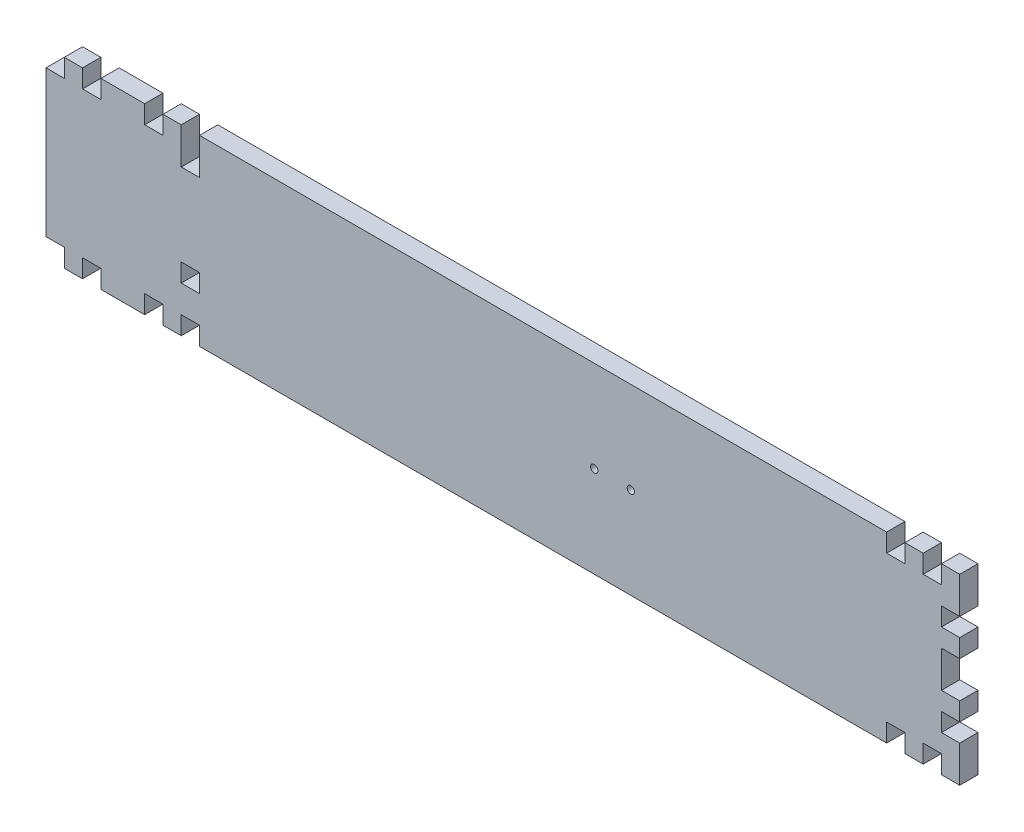
from build123d import *

# Parameters (mm, degrees)
ESQUISSE1_W              = 250
ESQUISSE1_H              = 25
BOSS_EXTRU_1_DEPTH       = 5
ESQUISSE2_W              = 5
ESQUISSE2_H              = 5
ENL_V_MAT_EXTRU_1_DEPTH  = 5
SYM_TRIE1_DEPTH          = 5
ESQUISSE3_W              = 5
ESQUISSE3_H              = 5
ENL_V_MAT_EXTRU_14_DEPTH = 5


# Read off the part's stored shape, not the designer's step: Symétrie1
with BuildPart() as part:
    # Esquisse1 → Boss.-Extru.1 (new body)
    with BuildSketch(Plane.XY):
        with Locations((60.132935366, -9.243939394)):
            Rectangle(ESQUISSE1_W, ESQUISSE1_H)
    extrude(amount=BOSS_EXTRU_1_DEPTH)

    # Esquisse2 → Enlèv. mat.-Extru.1 (cut)
    with BuildSketch(Plane.XY.offset(5)):
        with Locations((177.632935366, 0.756060606)):
            Rectangle(ESQUISSE2_W, ESQUISSE2_H)
        with Locations((167.632935366, 0.756060606)):
            Rectangle(ESQUISSE2_W, ESQUISSE2_H)
        with Locations((-25.367064634, 0.756060606)):
            Rectangle(ESQUISSE2_W, ESQUISSE2_H)
        with Locations((-35.367064634, 0.756060606)):
            Rectangle(ESQUISSE2_W, ESQUISSE2_H)
        with Locations((-52.367064634, 0.756060606)):
            Rectangle(ESQUISSE2_W, ESQUISSE2_H)
        with Locations((-62.367064634, 0.756060606)):
            Rectangle(ESQUISSE2_W, ESQUISSE2_H)
        with Locations((182.632935366, -9.243939394)):
            Rectangle(ESQUISSE2_W, ESQUISSE2_H)
        with Locations((182.632935366, -19.243939394)):
            Rectangle(ESQUISSE2_W, ESQUISSE2_H)
        with BuildLine():
            Line((84.132935366, -21.743939394), (85.132935366, -21.743939394))
            Line((85.132935366, -21.743939394), (86.132935366, -21.743939394))
            ThreePointArc((86.132935366, -21.743939394), (85.132935366, -20.743939394), (84.132935366, -21.743939394))
        make_face()
        with BuildLine():
            Line((94.132935366, -21.743939394), (95.132935366, -21.743939394))
            Line((95.132935366, -21.743939394), (96.132935366, -21.743939394))
            ThreePointArc((96.132935366, -21.743939394), (95.132935366, -20.743939394), (94.132935366, -21.743939394))
        make_face()
    extrude(amount=-ENL_V_MAT_EXTRU_1_DEPTH, mode=Mode.SUBTRACT)

    # Symétrie1 outline → Symétrie1 (add)
    with BuildSketch(Plane.XY):
        with BuildLine():
            Line((180.132935366, -31.743939394), (185.132935366, -31.743939394))
            Line((185.132935366, -31.743939394), (185.132935366, -26.743939394))
            Line((185.132935366, -26.743939394), (180.132935366, -26.743939394))
            Line((180.132935366, -26.743939394), (180.132935366, -21.743939394))
            Line((180.132935366, -21.743939394), (96.132935366, -21.743939394))
            ThreePointArc((96.132935366, -21.743939394), (95.132935366, -22.743939394), (94.132935366, -21.743939394))
            Line((94.132935366, -21.743939394), (86.132935366, -21.743939394))
            ThreePointArc((86.132935366, -21.743939394), (85.132935366, -22.743939394), (84.132935366, -21.743939394))
            Line((84.132935366, -21.743939394), (-64.867064634, -21.743939394))
            Line((-64.867064634, -21.743939394), (-64.867064634, -41.743939394))
            Line((-64.867064634, -41.743939394), (-59.867064634, -41.743939394))
            Line((-59.867064634, -41.743939394), (-59.867064634, -46.743939394))
            Line((-59.867064634, -46.743939394), (-54.867064634, -46.743939394))
            Line((-54.867064634, -46.743939394), (-54.867064634, -41.743939394))
            Line((-54.867064634, -41.743939394), (-49.867064634, -41.743939394))
            Line((-49.867064634, -41.743939394), (-49.867064634, -46.743939394))
            Line((-49.867064634, -46.743939394), (-37.867064634, -46.743939394))
            Line((-37.867064634, -46.743939394), (-37.867064634, -41.743939394))
            Line((-37.867064634, -41.743939394), (-32.867064634, -41.743939394))
            Line((-32.867064634, -41.743939394), (-32.867064634, -46.743939394))
            Line((-32.867064634, -46.743939394), (-27.867064634, -46.743939394))
            Line((-27.867064634, -46.743939394), (-27.867064634, -41.743939394))
            Line((-27.867064634, -41.743939394), (-22.867064634, -41.743939394))
            Line((-22.867064634, -41.743939394), (-22.867064634, -46.743939394))
            Line((-22.867064634, -46.743939394), (165.132935366, -46.743939394))
            Line((165.132935366, -46.743939394), (165.132935366, -41.743939394))
            Line((165.132935366, -41.743939394), (170.132935366, -41.743939394))
            Line((170.132935366, -41.743939394), (170.132935366, -46.743939394))
            Line((170.132935366, -46.743939394), (175.132935366, -46.743939394))
            Line((175.132935366, -46.743939394), (175.132935366, -41.743939394))
            Line((175.132935366, -41.743939394), (180.132935366, -41.743939394))
            Line((180.132935366, -41.743939394), (180.132935366, -46.743939394))
            Line((180.132935366, -46.743939394), (185.132935366, -46.743939394))
            Line((185.132935366, -46.743939394), (185.132935366, -36.743939394))
            Line((185.132935366, -36.743939394), (180.132935366, -36.743939394))
            Line((180.132935366, -36.743939394), (180.132935366, -31.743939394))
        make_face()
    extrude(amount=SYM_TRIE1_DEPTH)

    # Esquisse3 → Enlèv. mat.-Extru.14 (cut)
    with BuildSketch(Plane.XY.offset(5)):
        with Locations((-25.367064634, -4.243939394)):
            Rectangle(ESQUISSE3_W, ESQUISSE3_H)
        with Locations((-25.367064634, -31.743939394)):
            Rectangle(ESQUISSE3_W, ESQUISSE3_H)
    extrude(amount=-ENL_V_MAT_EXTRU_14_DEPTH, mode=Mode.SUBTRACT)


solid = part.part
